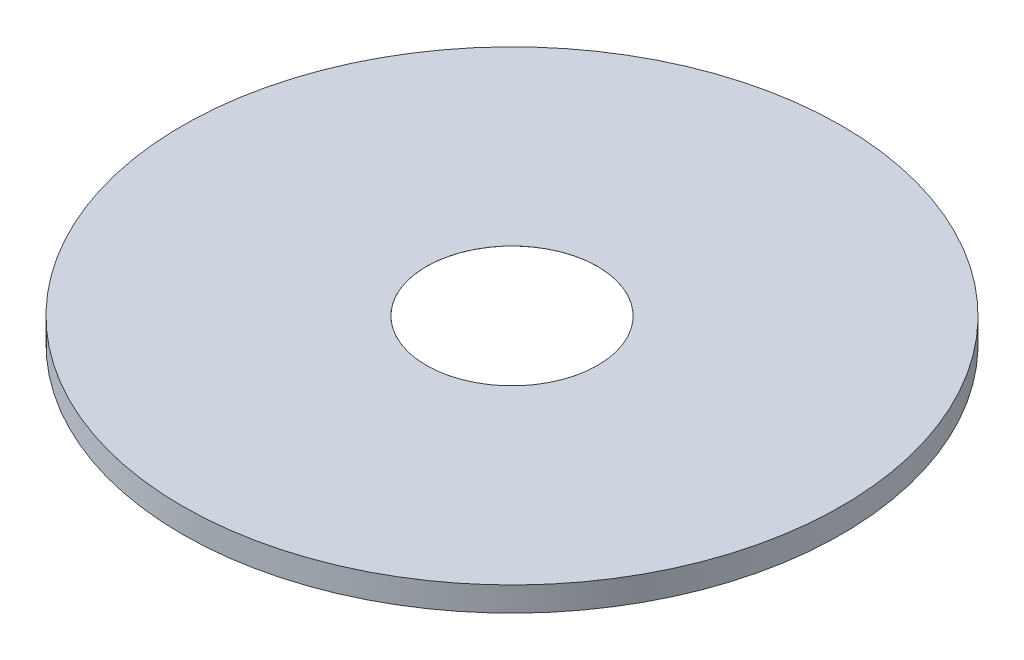
from build123d import *

# Parameters (mm, degrees)
SKETCH1_R           = 13.5
SKETCH1_R_2         = 3.51
BOSS_EXTRUDE1_DEPTH = 1


with BuildPart() as part:
    # Sketch1 → Boss-Extrude1 (new body)
    with BuildSketch(Plane(origin=(0, 0, 0), x_dir=(1, 0, 0), z_dir=(0, 1, 0))):
        Circle(SKETCH1_R)
        Circle(SKETCH1_R_2, mode=Mode.SUBTRACT)
    extrude(amount=BOSS_EXTRUDE1_DEPTH)

    # Sketch2 → Cut-Revolve1 (revolve, cut)
    with BuildSketch(Plane(origin=(0, 0, 0), x_dir=(0, 0, -1), z_dir=(1, 0, 0))):
        Polygon((-3.505, 1), (-5.298422916, 0), (-3.505, 0), align=None)
    revolve(axis=Axis((0, -2.060833688, 0), (0, 1, 0)), mode=Mode.SUBTRACT)


solid = part.part
